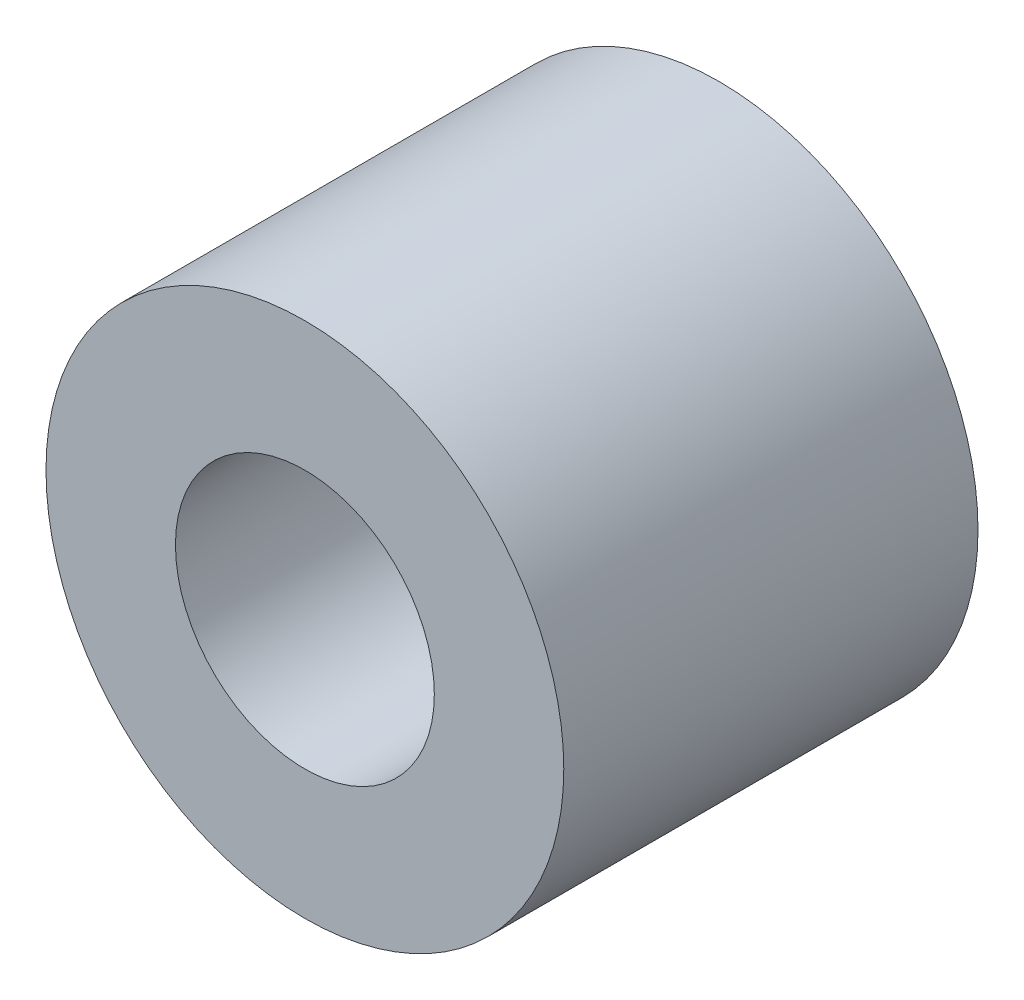
from build123d import *

# Parameters (mm, degrees)
SKETCH1_W = 50.8
SKETCH1_H = 15.875


with BuildPart() as part:
    # Sketch1 → Revolve1 (revolve)
    with BuildSketch(Plane(origin=(0, 0, 0), x_dir=(0, 0, -1), z_dir=(1, 0, 0))):
        with Locations((133.35, 1009.2055)):
            Rectangle(SKETCH1_W, SKETCH1_H)
    revolve(axis=Axis((0, 985.393, 0), (0, 0, -1)))


solid = part.part
